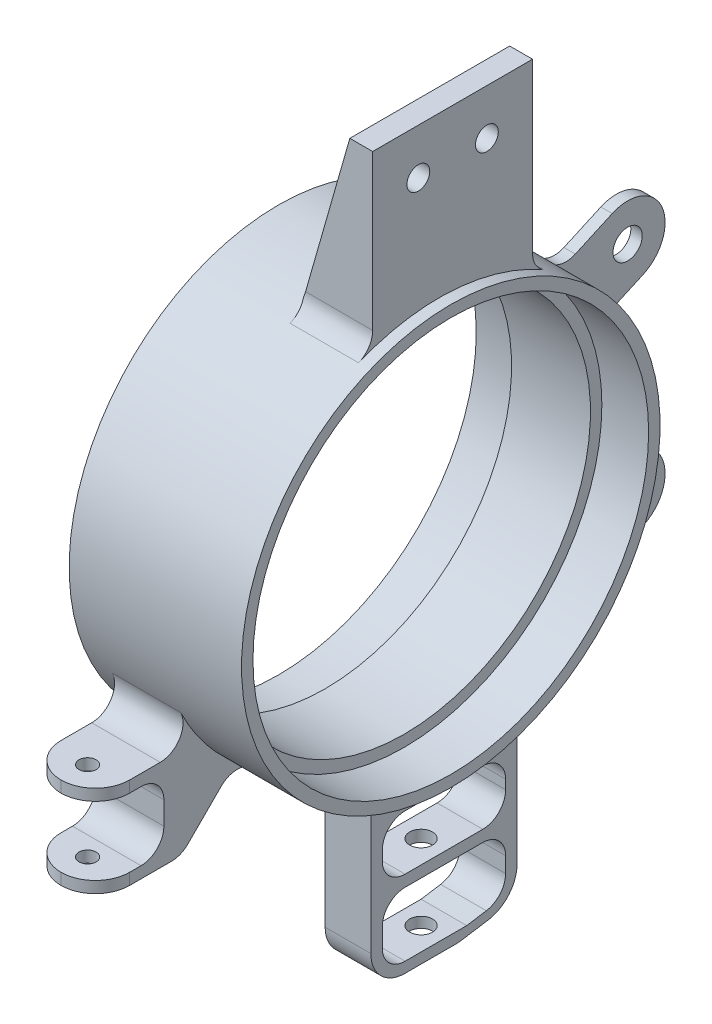
from build123d import *

# Parameters (mm, degrees)
BOSS_EXTRUDE1_REACH                  = 156.071
BOSS_EXTRUDE1_END_RADIUS             = 58.175
SKETCH2_W                            = 19.05
SKETCH2_H                            = 3.175
BOSS_EXTRUDE2_DEPTH                  = 44.45
BOSS_EXTRUDE2_DIRECTION_2_REACH      = 149.107
BOSS_EXTRUDE2_DIRECTION_2_END_RADIUS = 58.175
CUT_EXTRUDE1_DEPTH                   = 137.766929844
CUT_EXTRUDE1_DEPTH_BACK              = 137.766929844
BOSS_EXTRUDE3_REACH                  = 186.282
BOSS_EXTRUDE3_END_RADIUS             = 58.175
SKETCH7_W                            = 12.7
SKETCH7_H                            = 40.64
BOSS_EXTRUDE3_DIRECTION_2_DEPTH      = 53.975
SKETCH8_W                            = 34.29
SKETCH8_H                            = 15.24
CUT_EXTRUDE4_DEPTH                   = 140.379500782
SKETCH10_R                           = 4.064
BOSS_EXTRUDE5_DEPTH                  = 3.175
BOSS_EXTRUDE6_DEPTH                  = 19.05
CUT_EXTRUDE2_DEPTH                   = 165.455216673
CUT_EXTRUDE2_DEPTH_BACK              = 165.455216673
SKETCH6_R                            = 2.38125
SKETCH12_R                           = 3.175
CUT_EXTRUDE5_DEPTH                   = 144.448645948
F_0_25_FILLET5_R                     = 6.35
SKETCH13_R                           = 3.175
CUT_EXTRUDE6_DEPTH                   = 212.515467912
F_0_375_FILLET6_R                    = 9.525


# Some blends are built 0.0001 mm under size
with BuildPart() as part:
    # Sketch1 → Revolve1 (revolve)
    with BuildSketch(Plane.XY, mode=Mode.PRIVATE) as revolve1_sk:
        Polygon((47.925, 55), (34.925, 55), (34.925, 51.825), (13, 51.825), (13, 55), (0, 55), (0, 58.175), (47.925, 58.175), align=None)
    revolve(revolve1_sk.sketch.rotate(Axis((47.925, 0, 0), (-1, 0, 0)), 180), axis=Axis((47.925, 0, 0), (-1, 0, 0)))

    # Boss-Extrude1: up to this cylinder (the profile starts outside it)
    boss_extrude1_end = Plane(origin=(15.77905, 0, 0), z_dir=(-1, 0, 0)) * Cylinder(BOSS_EXTRUDE1_END_RADIUS, 429.492, mode=Mode.PRIVATE)
    # Sketch2 → Boss-Extrude1 (add, up to the surface)
    with BuildSketch(Plane.XY.offset(76.2), mode=Mode.PRIVATE) as boss_extrude1_sk1:
        with Locations((15.77904982, -35.8775)):
            Rectangle(SKETCH2_W, SKETCH2_H)
    boss_extrude1_tool1 = extrude(boss_extrude1_sk1.sketch, amount=-BOSS_EXTRUDE1_REACH, mode=Mode.PRIVATE) - boss_extrude1_end
    add(boss_extrude1_tool1.solids().sort_by_distance((15.77905, -35.8775, 76.2))[0])

    # Sketch4 → Boss-Extrude2 (add)
    with BuildSketch(Plane(origin=(0, 58.175, 0), x_dir=(1, 0, 0), z_dir=(0, 1, 0))):
        Polygon((38.336643231, 19.616687671), (38.336643231, -12.133312329), (25.636643231, -12.133312329), (25.636643231, -18.483312329), (44.686643231, -18.483312329), (44.686643231, 25.966687671), (25.636643231, 25.966687671), (25.636643231, 19.616687671), align=None)
    extrude(amount=BOSS_EXTRUDE2_DEPTH)

    # Boss-Extrude2 direction 2: up to this cylinder (the profile starts outside it)
    boss_extrude2_direction_2_end = Plane(origin=(38.820245, 0, 0), z_dir=(-1, 0, 0)) * Cylinder(BOSS_EXTRUDE2_DIRECTION_2_END_RADIUS, 415.564, mode=Mode.PRIVATE)
    # Sketch4 → Boss-Extrude2 direction 2 (add, up to the surface)
    with BuildSketch(Plane(origin=(0, 58.175, 0), x_dir=(1, 0, 0), z_dir=(0, 1, 0)), mode=Mode.PRIVATE) as boss_extrude2_direction_2_sk1:
        Polygon((38.336643231, 19.616687671), (38.336643231, -12.133312329), (25.636643231, -12.133312329), (25.636643231, -18.483312329), (44.686643231, -18.483312329), (44.686643231, 25.966687671), (25.636643231, 25.966687671), (25.636643231, 19.616687671), align=None)
    boss_extrude2_direction_2_tool1 = extrude(boss_extrude2_direction_2_sk1.sketch, amount=-BOSS_EXTRUDE2_DIRECTION_2_REACH, mode=Mode.PRIVATE) - boss_extrude2_direction_2_end
    add(boss_extrude2_direction_2_tool1.solids().sort_by_distance((38.820245, 58.175, -3.741688))[0])
    add(boss_extrude2_direction_2_tool1.solids().sort_by_distance((38.820245, 58.175, -3.741688))[1])

    # Sketch5 → Cut-Extrude1 (cut, two sides: drawn at the far end of the back side and taken through both)
    with BuildSketch(Plane.XY.offset(18.483312329).offset(-CUT_EXTRUDE1_DEPTH_BACK)):
        Polygon((38.336643231, 102.625), (25.636643231, 58.175), (25.636643231, 102.625), align=None)
    extrude(amount=CUT_EXTRUDE1_DEPTH + CUT_EXTRUDE1_DEPTH_BACK, mode=Mode.SUBTRACT)

    # Boss-Extrude3: up to this cylinder (the profile starts outside it)
    boss_extrude3_end = Plane(origin=(25.93905, 0, 0), z_dir=(-1, 0, 0)) * Cylinder(BOSS_EXTRUDE3_END_RADIUS, 489.914, mode=Mode.PRIVATE)
    # Sketch7 → Boss-Extrude3 (add, up to the surface)
    with BuildSketch(Plane(origin=(0, -58.175, 0), x_dir=(-1, 0, 0), z_dir=(0, -1, 0)), mode=Mode.PRIVATE) as boss_extrude3_sk1:
        with Locations((-25.93904982, 13.725369625)):
            Rectangle(SKETCH7_W, SKETCH7_H)
    boss_extrude3_tool1 = extrude(boss_extrude3_sk1.sketch, amount=-BOSS_EXTRUDE3_REACH, mode=Mode.PRIVATE) - boss_extrude3_end
    add(boss_extrude3_tool1.solids().sort_by_distance((25.93905, -58.175, -13.72537))[0])
    add(boss_extrude3_tool1.solids().sort_by_distance((25.93905, -58.175, -13.72537))[1])

    # Sketch7 → Boss-Extrude3 direction 2 (add)
    with BuildSketch(Plane(origin=(0, -58.175, 0), x_dir=(-1, 0, 0), z_dir=(0, -1, 0))):
        with Locations((-25.93904982, 13.725369625)):
            Rectangle(SKETCH7_W, SKETCH7_H)
    extrude(amount=BOSS_EXTRUDE3_DIRECTION_2_DEPTH)

    # Sketch8 → Cut-Extrude4 (cut, through all)
    with BuildSketch(Plane(origin=(32.28904982, 0, 0), x_dir=(0, 0, -1), z_dir=(1, 0, 0))):
        Polygon((-3.419630375, -109.22), (20.075369625, -109.22), (30.870369625, -107.524559238), (30.870369625, -91.44), (-3.419630375, -91.44), align=None)
        Polygon((17.790458535, -112.15), (34.045369625, -109.597036698), (34.045369625, -112.15), align=None)
        with Locations((13.725369625, -80.645)):
            Rectangle(SKETCH8_W, SKETCH8_H)
    extrude(amount=-CUT_EXTRUDE4_DEPTH, mode=Mode.SUBTRACT)

    # Sketch10 → Boss-Extrude5 (add)
    # profile 1 of 2: a face of its own
    with BuildSketch(Plane.ZY.offset(-30.0204)):
        with BuildLine():
            Line((-56.459518326, -14.023316846), (-71.344040827, -20.731727748))
            ThreePointArc((-71.344040827, -20.731727748), (-76.559272252, -34.505040827), (-62.785959173, -39.720272252))
            Line((-62.785959173, -39.720272252), (-47.901436671, -33.01186135))
            ThreePointArc((-47.901436671, -33.01186135), (-53.037189194, -23.903706562), (-56.459518326, -14.023316846))
        make_face()
        with Locations((-67.065, -30.226)):
            Circle(SKETCH10_R, mode=Mode.SUBTRACT)
    # profile 2 of 2: a face of its own
    with BuildSketch(Plane.ZY.offset(-30.0204)):
        with BuildLine():
            Line((-47.901436671, 33.01186135), (-62.785959173, 39.720272252))
            ThreePointArc((-62.785959173, 39.720272252), (-76.559272252, 34.505040827), (-71.344040827, 20.731727748))
            Line((-71.344040827, 20.731727748), (-56.459518326, 14.023316846))
            ThreePointArc((-56.459518326, 14.023316846), (-53.037189194, 23.903706562), (-47.901436671, 33.01186135))
        make_face()
        with Locations((-67.065, 30.226)):
            Circle(SKETCH10_R, mode=Mode.SUBTRACT)
    extrude(amount=BOSS_EXTRUDE5_DEPTH)

    # Sketch9 → Boss-Extrude6 (add)
    with BuildSketch(Plane(origin=(25.30404982, 0, 0), x_dir=(0, 0, -1), z_dir=(1, 0, 0))):
        with BuildLine():
            Line((-44.505105325, -37.465), (-57.15, -37.465))
            Line((-57.15, -37.465), (-57.15, -56.515))
            Line((-57.15, -56.515), (-76.2, -56.515))
            Line((-76.2, -56.515), (-76.2, -59.69))
            Line((-76.2, -59.69), (-52.361717737, -59.69))
            Line((-52.361717737, -59.69), (-37.308281085, -44.636563348))
            ThreePointArc((-37.308281085, -44.636563348), (-41.063552929, -41.208193916), (-44.505105325, -37.465))
        make_face()
    extrude(amount=-BOSS_EXTRUDE6_DEPTH)

    # Sketch6 → Cut-Extrude2 (cut, two sides: drawn at the far end of the back side and taken through both)
    with BuildSketch(Plane(origin=(0, -34.29, 0), x_dir=(1, 0, 0), z_dir=(0, 1, 0)).offset(-CUT_EXTRUDE2_DEPTH_BACK)):
        with Locations(Location((15.77904982, -68.824630375, 0), (0, 0, 270))):
            Circle(SKETCH6_R)
    extrude(amount=CUT_EXTRUDE2_DEPTH + CUT_EXTRUDE2_DEPTH_BACK, mode=Mode.SUBTRACT)

    # Sketch12 → Cut-Extrude5 (cut, through all)
    with BuildSketch(Plane(origin=(44.686643231, 0, 0), x_dir=(0, 0, -1), z_dir=(1, 0, 0))):
        with Locations((-5.783312329, 89.925)):
            Circle(SKETCH12_R)
        with Locations((13.266687671, 89.925)):
            Circle(SKETCH12_R)
    extrude(amount=-CUT_EXTRUDE5_DEPTH, mode=Mode.SUBTRACT)

    # 0.25 Fillet5
    # the kernel refuses this fillet: 6.35 mm, written as the material it adds along each edge
    with BuildSketch(Plane(origin=(32.28904982, -107.524559238, -30.870369625), x_dir=(0, -0.15515599305949537, 0.9878899826487371), z_dir=(-1, 0, 0))) as f_0_25_fillet5_piece_1:
        with BuildLine():
            CenterArc((F_0_25_FILLET5_R * 0.855200499832, F_0_25_FILLET5_R), F_0_25_FILLET5_R, 188.925843448, 81.074156552)
            Line((-F_0_25_FILLET5_R * 0.132689482816, F_0_25_FILLET5_R * 0.844844006941), (0, 0))
            Line((0, 0), (F_0_25_FILLET5_R * 0.855200499832, 0))
        make_face()
    extrude(amount=12.7)
    with BuildSketch(Plane(origin=(32.28904982, -73.025, 3.419630375), x_dir=(0, -1, 0), z_dir=(-1, 0, 0)), Plane(origin=(32.28904982, -109.22, 3.419630375), x_dir=(0, 0, -1), z_dir=(-1, 0, 0))) as f_0_25_fillet5_piece_2:
        with BuildLine():
            CenterArc((F_0_25_FILLET5_R, -F_0_25_FILLET5_R), F_0_25_FILLET5_R, 90, 90)
            Line((0, -F_0_25_FILLET5_R), (0, 0))
            Line((0, 0), (F_0_25_FILLET5_R, 0))
        make_face()
    extrude(amount=12.7)
    with BuildSketch(Plane(origin=(32.28904982, -73.025, -30.870369625), x_dir=(0, -1, 0), z_dir=(-1, 0, 0)), Plane(origin=(32.28904982, -88.265, -30.870369625), x_dir=(0, 0, 1), z_dir=(-1, 0, 0)), Plane(origin=(32.28904982, -91.44, -30.870369625), x_dir=(0, -1, 0), z_dir=(-1, 0, 0)), Plane(origin=(32.28904982, -91.44, 3.419630375), x_dir=(0, 0, -1), z_dir=(-1, 0, 0)), Plane(origin=(32.28904982, -88.265, 3.419630375), x_dir=(0, 1, 0), z_dir=(-1, 0, 0))) as f_0_25_fillet5_piece_3:
        with BuildLine():
            CenterArc((F_0_25_FILLET5_R, F_0_25_FILLET5_R), F_0_25_FILLET5_R, 180, 90)
            Line((0, F_0_25_FILLET5_R), (0, 0))
            Line((0, 0), (F_0_25_FILLET5_R, 0))
        make_face()
    extrude(amount=12.7)
    with BuildSketch(Plane(origin=(44.686643231, 55.160654369, 18.483312329), x_dir=(0, -0.35151738961608436, 0.9361813525153627), z_dir=(-1, 0, 0))) as f_0_25_fillet5_piece_4_section:
        with BuildLine():
            CenterArc((4.400109316, 6.345915666), F_0_25_FILLET5_R, 200.580153558, 67.36473838)
            Line((-1.544642273, 4.113780242), (0, 0))
            ThreePointArc((0, 0), (2.086196898, 0.037418286), (4.172393797, 0))
        make_face()
    f_0_25_fillet5_piece_4 = extrude(amount=19.05, mode=Mode.PRIVATE)
    f_0_25_fillet5_piece_4 = split(f_0_25_fillet5_piece_4, bisect_by=Plane(origin=(25.731447174, 58.506813799, 19.322974334), z_dir=(0.9615239476408232, -0.274721127897378, 0)), keep=Keep.TOP, mode=Mode.PRIVATE)
    add(f_0_25_fillet5_piece_4)
    with BuildSketch(Plane(origin=(44.686643231, 52.058253489, -25.966687671), x_dir=(0, -0.4738240547164129, -0.8806195348571924), z_dir=(-1, 0, 0))) as f_0_25_fillet5_piece_5:
        with BuildLine():
            CenterArc((3.795801918, -6.346960756), F_0_25_FILLET5_R, 91.772763927, 59.944424143)
            Line((-1.796132128, -3.338178008), (0, 0))
            ThreePointArc((0, 0), (1.799680331, -0.027843787), (3.599360662, 0))
        make_face()
    extrude(amount=19.05)
    with BuildSketch(Plane(origin=(30.0204, 14.023316846, -56.459518326), x_dir=(0, -0.9796608965162138, -0.2006602298340364), z_dir=(-1, 0, 0)), Plane(origin=(30.0204, -33.01186135, -47.901436671), x_dir=(0, -0.7991988749934746, 0.6010666836626071), z_dir=(-1, 0, 0))) as f_0_25_fillet5_piece_6:
        with BuildLine():
            CenterArc((5.080771787, -6.344553716), F_0_25_FILLET5_R, 92.373186914, 74.9414324)
            Line((-1.114228568, -4.95011096), (0, 0))
            ThreePointArc((0, 0), (2.40891523, -0.049895678), (4.81783046, 0))
        make_face()
    extrude(amount=3.175)
    with BuildSketch(Plane(origin=(30.0204, 33.01186135, -47.901436671), x_dir=(0, 0.7991988749934751, 0.6010666836626063), z_dir=(-1, 0, 0)), Plane(origin=(30.0204, -14.023316846, -56.459518326), x_dir=(0, 0.979660896516214, -0.20066022983403448), z_dir=(-1, 0, 0))) as f_0_25_fillet5_piece_7:
        with BuildLine():
            CenterArc((5.080771787, 6.344553716), F_0_25_FILLET5_R, 192.685380686, 74.9414324)
            Line((-1.114228568, 4.95011096), (0, 0))
            ThreePointArc((0, 0), (2.40891523, 0.049895678), (4.81783046, 0))
        make_face()
    extrude(amount=3.175)
    with BuildSketch(Plane(origin=(25.30404982, -34.29, 46.994962762), x_dir=(0, 0.85817592135249, 0.5133557129425999), z_dir=(-1, 0, 0))) as f_0_25_fillet5_piece_8:
        with BuildLine():
            CenterArc((11.182140281, -6.323575362), F_0_25_FILLET5_R, 95.228847915, 115.658763837)
            Line((5.73272318, -9.583384139), (0, 0))
            ThreePointArc((0, 0), (5.30171973, -0.242087136), (10.60343946, 0))
        make_face()
    extrude(amount=19.05)
    with BuildSketch(Plane(origin=(25.30404982, -44.636563348, 37.308281085), x_dir=(0, -0.6059500759148755, -0.7955026747275943), z_dir=(-1, 0, 0))) as f_0_25_fillet5_piece_9:
        with BuildLine():
            CenterArc((5.549833192, 6.343501146), F_0_25_FILLET5_R, 187.702760348, 79.704814697)
            Line((-0.742869129, 5.492385703), (0, 0))
            ThreePointArc((0, 0), (2.631308443, 0.059538711), (5.262616886, 0))
        make_face()
    extrude(amount=19.05)
    with BuildSketch(Plane(origin=(25.30404982, -56.515, 57.15), x_dir=(0, 1, 0), z_dir=(-1, 0, 0))) as f_0_25_fillet5_piece_10:
        with BuildLine():
            CenterArc((F_0_25_FILLET5_R, -F_0_25_FILLET5_R), F_0_25_FILLET5_R, 90, 90)
            Line((0, -F_0_25_FILLET5_R), (0, 0))
            Line((0, 0), (F_0_25_FILLET5_R, 0))
        make_face()
    extrude(amount=19.05)
    with BuildSketch(Plane(origin=(25.30404982, -37.465, 57.15), x_dir=(0, -1, 0), z_dir=(-1, 0, 0))) as f_0_25_fillet5_piece_11:
        with BuildLine():
            CenterArc((F_0_25_FILLET5_R, F_0_25_FILLET5_R), F_0_25_FILLET5_R, 180, 90)
            Line((0, F_0_25_FILLET5_R), (0, 0))
            Line((0, 0), (F_0_25_FILLET5_R, 0))
        make_face()
    extrude(amount=19.05)
    with BuildSketch(Plane(origin=(56.760806798, 56.895635658, 12.133312329), x_dir=(0, 0.14936777245731006, -0.9887817092519163), z_dir=(-1, 0, 0))) as f_0_25_fillet5_piece_12_section:
        with BuildLine():
            CenterArc((7.379554362, -6.338505022), F_0_25_FILLET5_R, 93.448024752, 95.142265083)
            Line((1.100790509, -7.286990377), (0, 0))
            ThreePointArc((0, 0), (3.498822942, -0.10531029), (6.997645885, 0))
        make_face()
    f_0_25_fillet5_piece_12 = extrude(amount=31.124163567, mode=Mode.PRIVATE)
    f_0_25_fillet5_piece_12 = split(f_0_25_fillet5_piece_12, bisect_by=Plane(origin=(44.686643231, 58.858626786, 10.536201491), z_dir=(-1, 0, 0)), keep=Keep.TOP, mode=Mode.PRIVATE)
    f_0_25_fillet5_piece_12 = split(f_0_25_fillet5_piece_12, bisect_by=Plane(origin=(26.305635106, 60.51647156, 10.536201491), z_dir=(0.9615239476408232, -0.274721127897378, 0)), keep=Keep.TOP, mode=Mode.PRIVATE)
    add(f_0_25_fillet5_piece_12)
    with BuildSketch(Plane(origin=(59.283100941, 54.76783901, -19.616687671), x_dir=(0, 0.272040051802825, 0.9622859295527064), z_dir=(-1, 0, 0))) as f_0_25_fillet5_piece_13_section:
        with BuildLine():
            CenterArc((8.389825829, 6.335138282), F_0_25_FILLET5_R, 164.214302048, 101.864940185)
            Line((2.279310176, 8.062592611), (0, 0))
            ThreePointArc((0, 0), (3.977816769, 0.136154399), (7.955633539, 0))
        make_face()
    f_0_25_fillet5_piece_13 = extrude(amount=33.64645771, mode=Mode.PRIVATE)
    f_0_25_fillet5_piece_13 = split(f_0_25_fillet5_piece_13, bisect_by=Plane(origin=(44.686643231, 57.303527037, -17.828373859), z_dir=(-1, 0, 0)), keep=Keep.TOP, mode=Mode.PRIVATE)
    f_0_25_fillet5_piece_13 = split(f_0_25_fillet5_piece_13, bisect_by=Plane(origin=(25.888622091, 59.056926007, -17.828373859), z_dir=(0.9615239476408232, -0.274721127897378, 0)), keep=Keep.TOP, mode=Mode.PRIVATE)
    add(f_0_25_fillet5_piece_13)
    # the kernel refuses this fillet: 6.35 mm, written as the material it takes off along each edge
    with BuildSketch(Plane(origin=(31.879690122, -59.69, 52.361717737), x_dir=(0, 0, 1), z_dir=(-1, 0, 0))) as f_0_25_fillet5_2_piece_1:
        with BuildLine():
            CenterArc((F_0_25_FILLET5_R * 0.414213562373, F_0_25_FILLET5_R), F_0_25_FILLET5_R, 225, 45)
            Line((-F_0_25_FILLET5_R * 0.292893218813, F_0_25_FILLET5_R * 0.292893218813), (0, 0))
            Line((0, 0), (F_0_25_FILLET5_R * 0.414213562373, 0))
        make_face()
    extrude(amount=32.201280605, mode=Mode.SUBTRACT)

    # Sketch13 → Cut-Extrude6 (cut, through all)
    with BuildSketch(Plane(origin=(0, -88.265, 0), x_dir=(1, 0, 0), z_dir=(0, 1, 0))):
        with Locations(Location((25.93904982, 13.725369625, 0), (0, 0, 180))):
            Circle(SKETCH13_R)
    extrude(amount=-CUT_EXTRUDE6_DEPTH, mode=Mode.SUBTRACT)

    # 0.375 Fillet6
    f_0_375_fillet6_edges = [part.edges().sort_by_distance(p)[0] for p in [
        (25.93904982, -47.172485965, -34.045369625),
        (25.93904982, -57.800012761, 6.594630375),
        (25.93904982, -109.597036698, -34.045369625),
        (25.93904982, -112.15, -17.790458535),
        (25.93904982, -112.15, 6.594630375),
        (25.30404982, -35.8775, 76.2),
        (6.25404982, -35.8775, 76.2),
        (6.25404982, -58.1025, 76.2),
        (25.30404982, -58.1025, 76.2),
    ]]
    fillet(f_0_375_fillet6_edges, radius=F_0_375_FILLET6_R - 0.0001)  # a hair under: the kernel refuses the full size


solid = part.part
